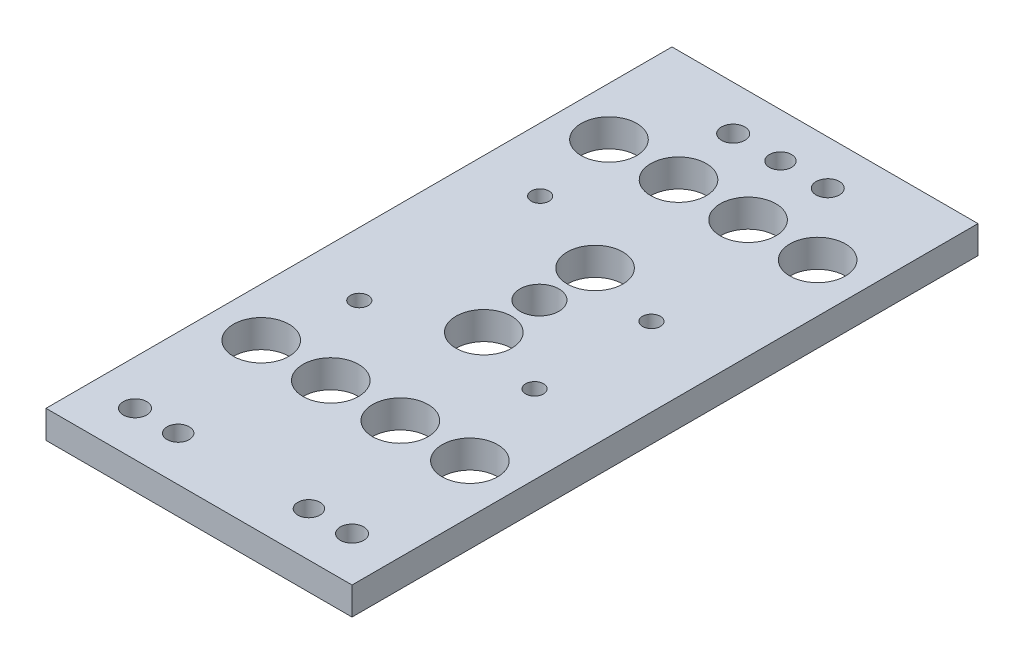
from build123d import *

# Parameters (mm, degrees)
SKETCH1_W             = 110
SKETCH1_H             = 225
BOSS_EXTRUDE1_DEPTH   = 10
M8_CLEARANCE_HOLE1_D  = 8.4
F_8_0MM_DOWEL_HOLE1_D = 8
CUT_EXTRUDE1_REACH    = 127.623
SKETCH8_R             = 7
M6_CLEARANCE_HOLE1_D  = 6.4
SKETCH14_R            = 10
CUT_EXTRUDE2_DEPTH    = 126.623445264


with BuildPart() as part:
    # Sketch1 → Boss-Extrude1 (new body)
    with BuildSketch(Plane(origin=(0, 0, 0), x_dir=(1, 0, 0), z_dir=(0, 1, 0))):
        Rectangle(SKETCH1_W, SKETCH1_H)
    extrude(amount=-BOSS_EXTRUDE1_DEPTH)

    # M8 Clearance Hole1 (through all)
    with Locations(Plane(origin=(0, 0, 0), x_dir=(1, 0, 0), z_dir=(0, 1, 0))):
        with Locations((-17, 96.5), (17, 96.5), (-39, -96.5), (39, -96.5)):
            Hole(M8_CLEARANCE_HOLE1_D / 2)

    # Ø8.0mm Dowel Hole1 (through all)
    with Locations(Plane(origin=(0, 0, 0), x_dir=(1, 0, 0), z_dir=(0, 1, 0))):
        with Locations((0, 96.5), (-23.5, -96.5), (23.5, -96.5)):
            Hole(F_8_0MM_DOWEL_HOLE1_D / 2)

    # Sketch8 → Cut-Extrude1 (cut, up to next)
    with BuildSketch(Plane(origin=(0, 0, 0), x_dir=(1, 0, 0), z_dir=(0, 1, 0)), mode=Mode.PRIVATE) as cut_extrude1_sk1:
        with Locations((0, 9.86)):
            Circle(SKETCH8_R)
    cut_extrude1_tool1 = extrude(cut_extrude1_sk1.sketch, amount=-CUT_EXTRUDE1_REACH, mode=Mode.PRIVATE) & part.part
    add(cut_extrude1_tool1.solids().sort_by_distance((0, 0, -9.86))[0], mode=Mode.SUBTRACT)

    # M6 Clearance Hole1 (through all)
    with Locations(Plane(origin=(0, 0, 0), x_dir=(1, 0, 0), z_dir=(0, 1, 0))):
        with Locations((26.75, 23.36), (26.75, -18.64), (-32.25, 42.36), (-32.25, -22.64)):
            Hole(M6_CLEARANCE_HOLE1_D / 2)

    # Sketch14 → Cut-Extrude2 (cut, through all)
    with BuildSketch(Plane(origin=(0, 0, 0), x_dir=(1, 0, 0), z_dir=(0, 1, 0))):
        with Locations((37.5, 72.36)):
            Circle(SKETCH14_R)
        with Locations((12.5, 72.36)):
            Circle(SKETCH14_R)
        with Locations((-12.5, 72.36)):
            Circle(SKETCH14_R)
        with Locations((-37.5, 72.36)):
            Circle(SKETCH14_R)
        with Locations((0, 29.86)):
            Circle(SKETCH14_R)
        with Locations((0, -10.14)):
            Circle(SKETCH14_R)
        with Locations((37.5, -52.64)):
            Circle(SKETCH14_R)
        with Locations((12.5, -52.64)):
            Circle(SKETCH14_R)
        with Locations((-12.5, -52.64)):
            Circle(SKETCH14_R)
        with Locations((-37.5, -52.64)):
            Circle(SKETCH14_R)
    extrude(amount=-CUT_EXTRUDE2_DEPTH, mode=Mode.SUBTRACT)


solid = part.part
